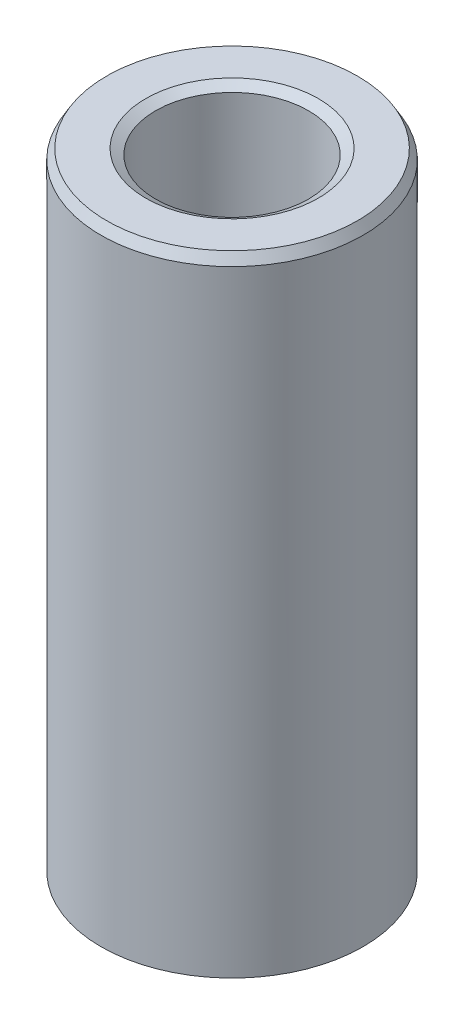
from build123d import *
from OCP.BRepFilletAPI import BRepFilletAPI_MakeChamfer

# Parameters (mm, degrees)
SKETCH1_R           = 12.5
BOSS_EXTRUDE1_DEPTH = 60.245349619
SKETCH2_R           = 7.300791798
CUT_EXTRUDE1_DEPTH  = 63.785365737
CHAMFER1_SIZE       = 0.933374179
CHAMFER1_SIZE2      = 0.538883834


with BuildPart() as part:
    # Sketch1 → Boss-Extrude1 (new body)
    with BuildSketch(Plane(origin=(0, 0, 0), x_dir=(1, 0, 0), z_dir=(0, 1, 0))):
        Circle(SKETCH1_R)
    extrude(amount=BOSS_EXTRUDE1_DEPTH)

    # Sketch2 → Cut-Extrude1 (cut, through all)
    with BuildSketch(Plane(origin=(0, 0, 0), x_dir=(1, 0, 0), z_dir=(0, 1, 0))):
        Circle(SKETCH2_R)
    extrude(amount=CUT_EXTRUDE1_DEPTH, mode=Mode.SUBTRACT)

    # Chamfer1: one chamfer whose edges measure the first distance from different faces: ONE call of the kernel's chamfer builder (chamfer() names one face for all edges)
    chamfer1_edges_1 = [part.edges().sort_by_distance(p)[0] for p in [
        (-7.300791798, 60.245349619, 0),
    ]]
    chamfer1_side_1 = [part.faces().sort_by_distance(p)[0] for p in [
        (-12.146446609, 60.245349619, 0),
    ]]
    chamfer1_edges_2 = [part.edges().sort_by_distance(p)[0] for p in [
        (-7.300791798, 0, 0),
    ]]
    chamfer1_side_2 = [part.faces().sort_by_distance(p)[0] for p in [
        (-7.300791798, 30.12267481, 0),
    ]]
    chamfer1_edges_3 = [part.edges().sort_by_distance(p)[0] for p in [
        (-12.5, 0, 0),
    ]]
    chamfer1_side_3 = [part.faces().sort_by_distance(p)[0] for p in [
        (-12.146446609, 0, 0),
    ]]
    chamfer1_edges_4 = [part.edges().sort_by_distance(p)[0] for p in [
        (-12.5, 60.245349619, 0),
    ]]
    chamfer1_side_4 = [part.faces().sort_by_distance(p)[0] for p in [
        (-12.5, 30.12267481, 0),
    ]]
    chamfer1 = BRepFilletAPI_MakeChamfer(part.part.solid().wrapped)
    for e in chamfer1_edges_1:
        chamfer1.Add(CHAMFER1_SIZE, CHAMFER1_SIZE2, e.wrapped, chamfer1_side_1[0].wrapped)  # the first distance lies on this face
    for e in chamfer1_edges_2:
        chamfer1.Add(CHAMFER1_SIZE, CHAMFER1_SIZE2, e.wrapped, chamfer1_side_2[0].wrapped)  # the first distance lies on this face
    for e in chamfer1_edges_3:
        chamfer1.Add(CHAMFER1_SIZE, CHAMFER1_SIZE2, e.wrapped, chamfer1_side_3[0].wrapped)  # the first distance lies on this face
    for e in chamfer1_edges_4:
        chamfer1.Add(CHAMFER1_SIZE, CHAMFER1_SIZE2, e.wrapped, chamfer1_side_4[0].wrapped)  # the first distance lies on this face
    add(Compound.cast(chamfer1.Shape()), mode=Mode.REPLACE)


solid = part.part
